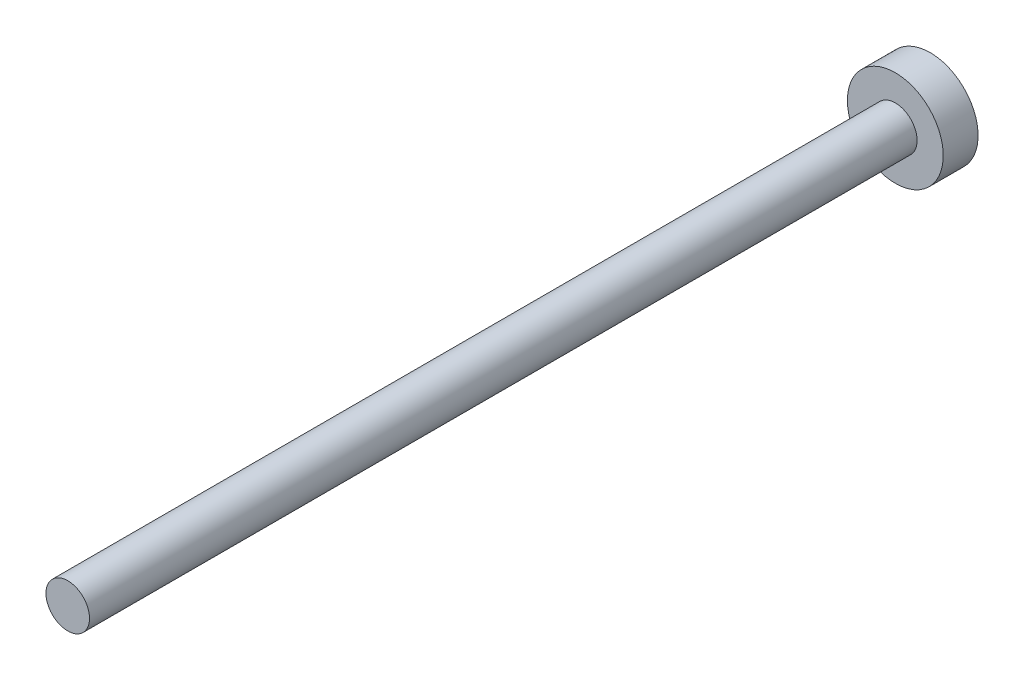
from build123d import *

# Parameters (mm, degrees)
SKETCH1_R           = 2.5
BOSS_EXTRUDE1_DEPTH = 47.5
SKETCH2_R           = 5.5
BOSS_EXTRUDE2_DEPTH = 4


with BuildPart() as part:
    # Sketch1 → Boss-Extrude1 (new, symmetric)
    with BuildSketch(Plane.XY):
        Circle(SKETCH1_R)
    extrude(amount=BOSS_EXTRUDE1_DEPTH, both=True)

    # Sketch2 → Boss-Extrude2 (add)
    with BuildSketch(Plane(origin=(0, 0, -47.5), x_dir=(-1, 0, 0), z_dir=(0, 0, -1))):
        Circle(SKETCH2_R)
    extrude(amount=BOSS_EXTRUDE2_DEPTH)


solid = part.part
